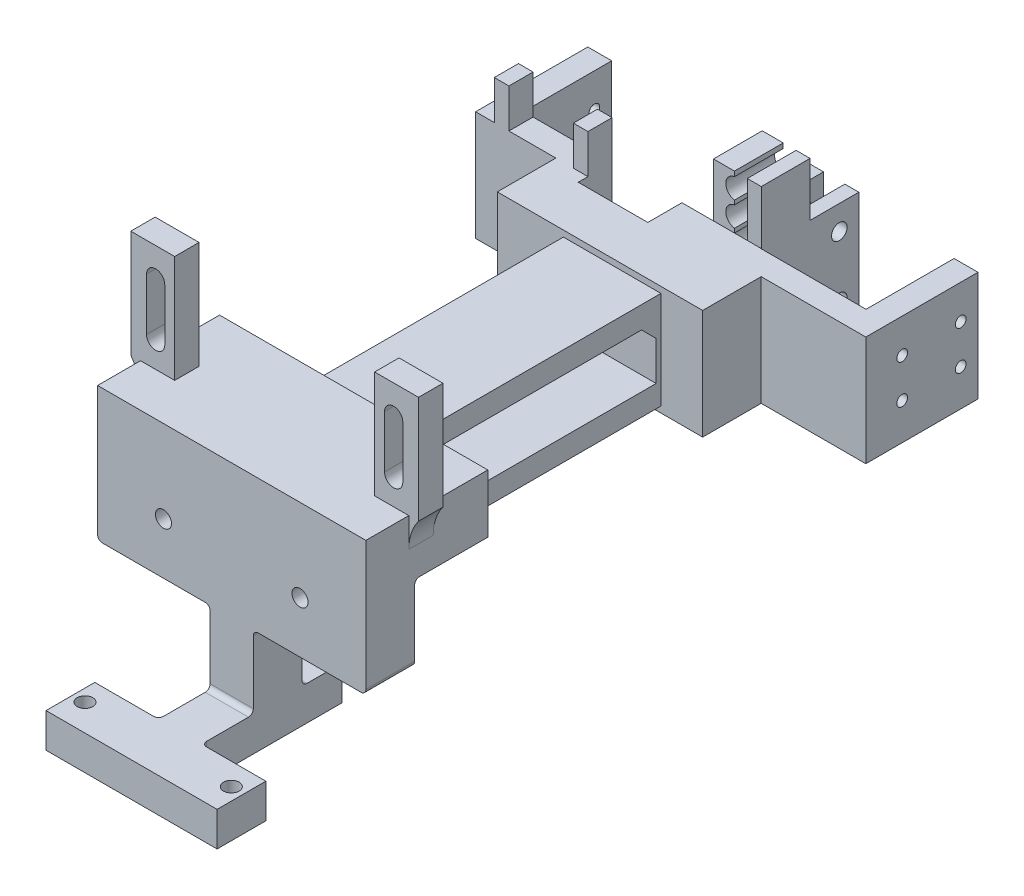
from build123d import *

# Parameters (mm, degrees)
SKETCH_1_W            = 35
SKETCH_1_H            = 40
EXTRUDE_1_DEPTH       = 5
SKETCH_2_W            = 20
SKETCH_2_H            = 20
EXTRUDE_2_DEPTH       = 65
SKETCH_3_W            = 56
SKETCH_3_H            = 11
SKETCH_3_W_2          = 4.5
CUT_EXTRUDE_1_DEPTH   = 78.821912081
SKETCH_5_W            = 55
SKETCH_5_H            = 20
EXTRUDE_3_DEPTH       = 25
SKETCH_9_R            = 1.65
CUT_EXTRUDE_3_DEPTH   = 27
SKETCH_10_W           = 55
SKETCH_10_H           = 25
EXTRUDE_4_DEPTH       = 4.9
SKETCH_11_W           = 7
SKETCH_11_H           = 5
EXTRUDE_5_DEPTH       = 21
CHAMFER_2_SIZE        = 10
CHAMFER_3_SIZE        = 3
CHAMFER_4_SIZE        = 2
CUT_EXTRUDE_7_DEPTH   = 15
SKETCH_16_W           = 12.984556049
SKETCH_16_H           = 11
EXTRUDE_6_DEPTH       = 20
CHAMFER_5_SIZE        = 3
SKETCH_19_R           = 1.6
CUT_EXTRUDE_10_DEPTH  = 10
FILLET_1_R            = 5
SKETCH_20_W           = 5
SKETCH_20_H           = 22.5
EXTRUDE_7_DEPTH       = 17.5
SKETCH_21_W           = 5
SKETCH_21_H           = 22.5
EXTRUDE_8_DEPTH       = 5
SKETCH_22_W           = 5
SKETCH_22_H           = 22.5
EXTRUDE_9_DEPTH       = 10
SKETCH_23_W           = 5
SKETCH_23_H           = 22.5
EXTRUDE_10_DEPTH      = 10
SKETCH_24_W           = 3.3
SKETCH_24_H           = 22.5
EXTRUDE_11_DEPTH      = 4
SKETCH_26_W           = 5
SKETCH_26_H           = 22.5
EXTRUDE_13_DEPTH      = 17.5
SKETCH_27_W           = 5
SKETCH_27_H           = 22.5
EXTRUDE_14_DEPTH      = 5
SKETCH_28_W           = 5
SKETCH_28_H           = 22.5
EXTRUDE_15_DEPTH      = 10
SKETCH_29_W           = 5
SKETCH_29_H           = 22.5
EXTRUDE_16_DEPTH      = 10
SKETCH_31_W           = 3.4
SKETCH_31_H           = 22.5
EXTRUDE_18_DEPTH      = 4
SKETCH_39_W           = 7.13678645
SKETCH_39_H           = 13.518332953
SKETCH_39_W_2         = 8.139264071
SKETCH_39_H_2         = 10.52230198
CUT_EXTRUDE_17_DEPTH  = 35
SKETCH_40_W           = 55
SKETCH_40_H           = 10
EXTRUDE_20_DEPTH      = 25.575713879
SKETCH_41_W           = 8.84873954
SKETCH_41_H           = 7.046133319
EXTRUDE_21_DEPTH      = 20.577981656
EXTRUDE_22_DEPTH      = 13.07563
EXTRUDE_22_DEPTH_BACK = 22
SKETCH_42_W           = 38.79276714
SKETCH_42_H           = 7.046133319
SKETCH_43_W           = 23.07563023
SKETCH_43_H           = 28.79276714
CUT_EXTRUDE_18_DEPTH  = 22
FILLET_3_R            = 1
SKETCH_46_W           = 9.238205764
SKETCH_46_H           = 22.5
EXTRUDE_26_DEPTH      = 10
CUT_EXTRUDE_19_DEPTH  = 10
SKETCH_48_R           = 1.6
CUT_EXTRUDE_20_DEPTH  = 10
CUT_EXTRUDE_21_DEPTH  = 10
SKETCH_50_W           = 2.57104036
SKETCH_50_H           = 22.5
SKETCH_50_W_2         = 2.865096637
EXTRUDE_27_DEPTH      = 10
SKETCH_53_W           = 4.304606657
SKETCH_53_H           = 10
SKETCH_53_W_2         = 2.865096637
EXTRUDE_28_DEPTH      = 11
SKETCH_51_R           = 1.6
CUT_EXTRUDE_22_DEPTH  = 12
SKETCH_52_W           = 17.2
SKETCH_52_H           = 6.8
CUT_EXTRUDE_23_DEPTH  = 39
CUT_EXTRUDE_24_DEPTH  = 10
SKETCH_55_W           = 32
SKETCH_55_H           = 22.5
EXTRUDE_29_DEPTH      = 12
SKETCH_56_W           = 10.301119562
SKETCH_56_H           = 22.5
CUT_EXTRUDE_25_DEPTH  = 7
SKETCH_57_W           = 3
SKETCH_57_H           = 4.95
EXTRUDE_30_DEPTH      = 8
SKETCH_58_W           = 9
SKETCH_58_H           = 22.5
SKETCH_58_W_2         = 8.434386946
CUT_EXTRUDE_26_DEPTH  = 10.05
CUT_EXTRUDE_27_DEPTH  = 1
SKETCH_60_W           = 2.55
SKETCH_60_H           = 22.5
EXTRUDE_31_DEPTH      = 12
SKETCH_61_W           = 3.965384327
SKETCH_61_H           = 22.5
CUT_EXTRUDE_28_DEPTH  = 6.95
SKETCH_62_W           = 5
SKETCH_62_H           = 22
EXTRUDE_32_DEPTH      = 2
SKETCH_63_W           = 5
SKETCH_63_H           = 22
EXTRUDE_33_DEPTH      = 2
FILLET_4_R            = 10
SKETCH_64_W           = 5
SKETCH_64_H           = 22.5
EXTRUDE_34_DEPTH      = 8
SKETCH_65_W           = 0.1
SKETCH_65_H           = 22.5
CUT_EXTRUDE_30_DEPTH  = 15
SKETCH_66_W           = 5
SKETCH_66_H           = 22.5
EXTRUDE_35_DEPTH      = 8
SKETCH_67_R           = 1.1
CUT_EXTRUDE_31_DEPTH  = 9
SKETCH_68_W           = 0.1
SKETCH_68_H           = 22.5
CUT_EXTRUDE_32_DEPTH  = 12
SKETCH_69_W           = 12
SKETCH_69_H           = 22.5
EXTRUDE_36_DEPTH      = 5


with BuildPart() as part:
    # 草图1 → 凸台-拉伸1 (new body)
    with BuildSketch(Plane.XY):
        Rectangle(SKETCH_1_W, SKETCH_1_H)
    extrude(amount=EXTRUDE_1_DEPTH)

    # 草图2 → 凸台-拉伸2 (add)
    with BuildSketch(Plane.XY.offset(5)):
        Rectangle(SKETCH_2_W, SKETCH_2_H)
    extrude(amount=EXTRUDE_2_DEPTH)

    # 草图3 → 切除-拉伸1 (cut, through all)
    with BuildSketch(Plane.ZY.offset(10)):
        with Locations((37.5, 0)):
            Rectangle(SKETCH_3_W, SKETCH_3_H)
        with Locations((7.25, 0)):
            Rectangle(SKETCH_3_W_2, SKETCH_3_H)
    extrude(amount=-CUT_EXTRUDE_1_DEPTH, mode=Mode.SUBTRACT)

    # 草图5 → 凸台-拉伸3 (add)
    with BuildSketch(Plane.XY.offset(70)):
        Rectangle(SKETCH_5_W, SKETCH_5_H)
    extrude(amount=EXTRUDE_3_DEPTH)

    # 草图9 → 切除-拉伸3 (cut)
    with BuildSketch(Plane.XY.offset(95)):
        with Locations((-14, -3.042747006)):
            Circle(SKETCH_9_R)
        with Locations((14, -3.042747006)):
            Circle(SKETCH_9_R)
    extrude(amount=-CUT_EXTRUDE_3_DEPTH, mode=Mode.SUBTRACT)

    # 草图10 → 凸台-拉伸4 (add)
    with BuildSketch(Plane(origin=(0, 10, 0), x_dir=(1, 0, 0), z_dir=(0, 1, 0))):
        with Locations((0, -82.5)):
            Rectangle(SKETCH_10_W, SKETCH_10_H)
    extrude(amount=EXTRUDE_4_DEPTH)

    # 草图11 → 凸台-拉伸5 (add)
    with BuildSketch(Plane(origin=(0, 14.9, 0), x_dir=(1, 0, 0), z_dir=(0, 1, 0))):
        with Locations((-24, -83.7)):
            Rectangle(SKETCH_11_W, SKETCH_11_H)
        with Locations((24, -83.7)):
            Rectangle(SKETCH_11_W, SKETCH_11_H)
    extrude(amount=EXTRUDE_5_DEPTH)

    # 倒角2
    chamfer_2_edges = [part.edges().sort_by_distance(p)[0] for p in [
        (0, -5.5, 65.5),
    ]]
    chamfer(chamfer_2_edges, length=CHAMFER_2_SIZE)

    # 倒角3
    chamfer_3_edges = [part.edges().sort_by_distance(p)[0] for p in [
        (0, 10, 70),
    ]]
    chamfer(chamfer_3_edges, length=CHAMFER_3_SIZE)

    # 倒角4
    chamfer_4_edges = [part.edges().sort_by_distance(p)[0] for p in [
        (0, -10, 5),
    ]]
    chamfer(chamfer_4_edges, length=CHAMFER_4_SIZE)

    # 草图15 → 切除-拉伸7 (cut)
    with BuildSketch(Plane(origin=(0, 0, 70), x_dir=(-1, 0, 0), z_dir=(0, 0, -1))):
        Polygon((10, 1.957252994), (29.13083687, 1.957252994), (29.13083687, -8.042747006), (29.13083687, -10), (10, -10), (10, -8.042747006), align=None)
        Polygon((-29.13083687, 1.957252994), (-29.13083687, -8.042747006), (-29.13083687, -10), (-10, -10), (-10, -8.042747006), (-10, 1.957252994), align=None)
    extrude(amount=-CUT_EXTRUDE_7_DEPTH, mode=Mode.SUBTRACT)

    # 草图16 → 凸台-拉伸6 (add)
    with BuildSketch(Plane.ZY.offset(10)):
        with Locations((11.492278025, 0)):
            Rectangle(SKETCH_16_W, SKETCH_16_H)
    extrude(amount=-EXTRUDE_6_DEPTH)

    # 倒角5
    chamfer_5_edges = [part.edges().sort_by_distance(p)[0] for p in [
        (0, 5.5, 17.984556049),
    ]]
    chamfer(chamfer_5_edges, length=CHAMFER_5_SIZE)

    # 草图19 → 切除-拉伸10 (cut)
    with BuildSketch(Plane.XY.offset(86.2)):
        with Locations((-24.4, 29.9)):
            Circle(SKETCH_19_R)
        with Locations((-24.4, 19.9)):
            Circle(SKETCH_19_R)
        with Locations((24.4, 19.9)):
            Circle(SKETCH_19_R)
        with Locations((24.4, 29.9)):
            Circle(SKETCH_19_R)
    extrude(amount=-CUT_EXTRUDE_10_DEPTH, mode=Mode.SUBTRACT)

    # 圆角1
    fillet_1_edges = [part.edges().sort_by_distance(p)[0] for p in [
        (17.5, -20, 2.5),
        (-17.5, -20, 2.5),
        (-17.5, 20, 2.5),
        (17.5, 20, 2.5),
    ]]
    fillet(fillet_1_edges, radius=FILLET_1_R)

    # 草图20 → 凸台-拉伸7 (add)
    with BuildSketch(Plane.ZY.offset(17.5)):
        with Locations((2.5, 0)):
            Rectangle(SKETCH_20_W, SKETCH_20_H)
    extrude(amount=EXTRUDE_7_DEPTH)

    # 草图21 → 凸台-拉伸8 (add)
    with BuildSketch(Plane.ZY.offset(35)):
        with Locations((2.5, 0)):
            Rectangle(SKETCH_21_W, SKETCH_21_H)
    extrude(amount=EXTRUDE_8_DEPTH)

    # 草图22 → 凸台-拉伸9 (add)
    with BuildSketch(Plane(origin=(0, 0, 0), x_dir=(-1, 0, 0), z_dir=(0, 0, -1))):
        with Locations((37.5, 0)):
            Rectangle(SKETCH_22_W, SKETCH_22_H)
    extrude(amount=EXTRUDE_9_DEPTH)

    # 草图23 → 凸台-拉伸10 (add)
    with BuildSketch(Plane(origin=(0, 0, 0), x_dir=(-1, 0, 0), z_dir=(0, 0, -1))):
        with Locations((15.5, 0)):
            Rectangle(SKETCH_23_W, SKETCH_23_H)
    extrude(amount=EXTRUDE_10_DEPTH)

    # 草图24 → 凸台-拉伸11 (add)
    with BuildSketch(Plane.ZY.offset(18)):
        with Locations((-8.35, 0)):
            Rectangle(SKETCH_24_W, SKETCH_24_H)
    extrude(amount=EXTRUDE_11_DEPTH)

    # 草图26 → 凸台-拉伸13 (add)
    with BuildSketch(Plane(origin=(17.5, 0, 0), x_dir=(0, 0, -1), z_dir=(1, 0, 0))):
        with Locations((-2.5, 0)):
            Rectangle(SKETCH_26_W, SKETCH_26_H)
    extrude(amount=EXTRUDE_13_DEPTH)

    # 草图27 → 凸台-拉伸14 (add)
    with BuildSketch(Plane(origin=(35, 0, 0), x_dir=(0, 0, -1), z_dir=(1, 0, 0))):
        with Locations((-2.5, 0)):
            Rectangle(SKETCH_27_W, SKETCH_27_H)
    extrude(amount=EXTRUDE_14_DEPTH)

    # 草图28 → 凸台-拉伸15 (add)
    with BuildSketch(Plane(origin=(0, 0, 0), x_dir=(-1, 0, 0), z_dir=(0, 0, -1))):
        with Locations((-37.5, 0)):
            Rectangle(SKETCH_28_W, SKETCH_28_H)
    extrude(amount=EXTRUDE_15_DEPTH)

    # 草图29 → 凸台-拉伸16 (add)
    with BuildSketch(Plane(origin=(0, 0, 0), x_dir=(-1, 0, 0), z_dir=(0, 0, -1))):
        with Locations((-15.5, 0)):
            Rectangle(SKETCH_29_W, SKETCH_29_H)
    extrude(amount=EXTRUDE_16_DEPTH)

    # 草图31 → 凸台-拉伸18 (add)
    with BuildSketch(Plane(origin=(18, 0, 0), x_dir=(0, 0, -1), z_dir=(1, 0, 0))):
        with Locations((8.3, 0)):
            Rectangle(SKETCH_31_W, SKETCH_31_H)
    extrude(amount=EXTRUDE_18_DEPTH)

    # 草图39 → 切除-拉伸17 (cut)
    with BuildSketch(Plane.ZY.offset(17.5)):
        with Locations((3.568393225, 18.009166476)):
            Rectangle(SKETCH_39_W, SKETCH_39_H)
        with Locations((4.069632036, -16.51115099)):
            Rectangle(SKETCH_39_W_2, SKETCH_39_H_2)
    extrude(amount=-CUT_EXTRUDE_17_DEPTH, mode=Mode.SUBTRACT)

    # 草图40 → 凸台-拉伸20 (add)
    with BuildSketch(Plane.XZ.offset(10)):
        with Locations((0, 90)):
            Rectangle(SKETCH_40_W, SKETCH_40_H)
    extrude(amount=EXTRUDE_20_DEPTH)

    # 草图41 → 凸台-拉伸21 (add)
    with BuildSketch(Plane.XY.offset(95)):
        with Locations((0, -32.05264722)):
            Rectangle(SKETCH_41_W, SKETCH_41_H)
    extrude(amount=EXTRUDE_21_DEPTH)

    # 草图42 → 凸台-拉伸22 (add, two sides: drawn at the far end of the back side and taken through both)
    with BuildSketch(Plane.ZY.offset(4.42436977).offset(-EXTRUDE_22_DEPTH_BACK)):
        with Locations((96.181598086, -32.05264722)):
            Rectangle(SKETCH_42_W, SKETCH_42_H)
    extrude(amount=EXTRUDE_22_DEPTH + EXTRUDE_22_DEPTH_BACK)

    # 草图43 → 切除-拉伸18 (cut)
    with BuildSketch(Plane.XZ.offset(35.575713879)):
        with Locations((15.962184885, 91.181598086)):
            Rectangle(SKETCH_43_W, SKETCH_43_H)
        with Locations((-15.962184885, 91.181598086)):
            Rectangle(SKETCH_43_W, SKETCH_43_H)
    extrude(amount=-CUT_EXTRUDE_18_DEPTH, mode=Mode.SUBTRACT)

    # 圆角3
    fillet_3_edges = [part.edges().sort_by_distance(p)[0] for p in [
        (-18.75, 1.957252994, 85),
        (18.75, 1.957252994, 85),
        (0, -10, 85),
        (0, -28.52958056, 85),
        (0, -28.52958056, 95),
        (4.42436977, -32.052647219, 105.577981656),
        (27.5, -13.575713879, 90),
        (4.42436977, -13.575713879, 90),
        (-27.5, -13.575713879, 90),
        (-4.42436977, -32.052647219, 105.577981656),
        (-4.42436977, -13.575713879, 90),
    ]]
    fillet(fillet_3_edges, radius=FILLET_3_R)

    # 草图46 → 凸台-拉伸26 (add)
    with BuildSketch(Plane(origin=(0, 0, 0), x_dir=(-1, 0, 0), z_dir=(0, 0, -1))):
        with Locations((-8.380897118, 0)):
            Rectangle(SKETCH_46_W, SKETCH_46_H)
    extrude(amount=EXTRUDE_26_DEPTH)

    # 草图47 → 切除-拉伸19 (cut)
    with BuildSketch(Plane(origin=(0, 0, -10), x_dir=(-1, 0, 0), z_dir=(0, 0, -1))):
        with BuildLine():
            Line((-8.066400893, 11.25), (-10.700516417, 11.25))
            Line((-10.700516417, 11.25), (-10.700516417, -11.25))
            Line((-10.700516417, -11.25), (-6.332834596, -11.25))
            ThreePointArc((-6.332834596, -11.25), (-6.663682414, -9.62836823), (-8.066400893, -8.75))
            Line((-8.066400893, -8.75), (-8.066400893, -7.900028072))
            ThreePointArc((-8.066400893, -7.900028072), (-6.289381928, -5.825014036), (-8.066400893, -3.75))
            Line((-8.066400893, -3.75), (-8.066400893, -2.900028072))
            ThreePointArc((-8.066400893, -2.900028072), (-6.289381928, -0.825014036), (-8.066400893, 1.25))
            Line((-8.066400893, 1.25), (-8.066400893, 2.099971928))
            ThreePointArc((-8.066400893, 2.099971928), (-6.289381928, 4.174985964), (-8.066400893, 6.25))
            Line((-8.066400893, 6.25), (-8.066400893, 7.099971928))
            ThreePointArc((-8.066400893, 7.099971928), (-6.289381928, 9.174985964), (-8.066400893, 11.25))
        make_face()
    extrude(amount=-CUT_EXTRUDE_19_DEPTH, mode=Mode.SUBTRACT)

    # 草图48 → 切除-拉伸20 (cut)
    with BuildSketch(Plane(origin=(0, -28.52958056, 0), x_dir=(1, 0, 0), z_dir=(0, 1, 0))):
        with Locations(Location((15, -110.089556655, 0), (0, 0, 270))):
            Circle(SKETCH_48_R)
        with Locations(Location((-15, -110.089556655, 0), (0, 0, 270))):
            Circle(SKETCH_48_R)
    extrude(amount=-CUT_EXTRUDE_20_DEPTH, mode=Mode.SUBTRACT)

    # 草图49 → 切除-拉伸21 (cut)
    with BuildSketch(Plane.XY.offset(86.2)):
        with BuildLine():
            Line((-22.528691915, 29.9), (-22.528691915, 19.165676086))
            ThreePointArc((-22.528691915, 19.165676086), (-24.4, 17.294368), (-26.271308085, 19.165676086))
            Line((-26.271308085, 19.165676086), (-26.271308085, 29.9))
            ThreePointArc((-26.271308085, 29.9), (-24.4, 31.771308085), (-22.528691915, 29.9))
        make_face()
        with BuildLine():
            Line((22.528691915, 29.9), (22.528691915, 19.165676086))
            ThreePointArc((22.528691915, 19.165676086), (24.4, 17.294368), (26.271308085, 19.165676086))
            Line((26.271308085, 19.165676086), (26.271308085, 29.9))
            ThreePointArc((26.271308085, 29.9), (24.4, 31.771308085), (22.528691915, 29.9))
        make_face()
    extrude(amount=-CUT_EXTRUDE_21_DEPTH, mode=Mode.SUBTRACT)

    # 草图50 → 凸台-拉伸27 (add)
    with BuildSketch(Plane(origin=(0, 0, -10), x_dir=(-1, 0, 0), z_dir=(0, 0, -1))):
        with Locations((-5.047314416, 0)):
            Rectangle(SKETCH_50_W, SKETCH_50_H)
        with Locations((-12.133064736, 0)):
            Rectangle(SKETCH_50_W_2, SKETCH_50_H)
    extrude(amount=EXTRUDE_27_DEPTH)

    # 草图53 → 凸台-拉伸28 (add)
    with BuildSketch(Plane(origin=(0, 11.25, 0), x_dir=(1, 0, 0), z_dir=(0, 1, 0))):
        with Locations((5.914097565, 5)):
            Rectangle(SKETCH_53_W, SKETCH_53_H)
        with Locations((12.133064736, 5)):
            Rectangle(SKETCH_53_W_2, SKETCH_53_H)
    extrude(amount=EXTRUDE_28_DEPTH)

    # 草图51 → 切除-拉伸22 (cut)
    with BuildSketch(Plane(origin=(13.565613054, 0, 0), x_dir=(0, 0, -1), z_dir=(1, 0, 0))):
        with Locations((16, 6.25)):
            Circle(SKETCH_51_R)
        with Locations((16, -6.25)):
            Circle(SKETCH_51_R)
    extrude(amount=-CUT_EXTRUDE_22_DEPTH, mode=Mode.SUBTRACT)

    # 草图52 → 切除-拉伸23 (cut)
    with BuildSketch(Plane(origin=(0, 11.25, 0), x_dir=(1, 0, 0), z_dir=(0, 1, 0))):
        with Locations((-26.5, 3.35)):
            Rectangle(SKETCH_52_W, SKETCH_52_H)
        with Locations((26.5, 3.35)):
            Rectangle(SKETCH_52_W, SKETCH_52_H)
    extrude(amount=-CUT_EXTRUDE_23_DEPTH, mode=Mode.SUBTRACT)

    # 草图54 → 切除-拉伸24 (cut)
    with BuildSketch(Plane(origin=(0, 0, -10), x_dir=(-1, 0, 0), z_dir=(0, 0, -1))):
        with BuildLine():
            ThreePointArc((-8.066400893, 12.099971928), (-6.289381928, 14.174985964), (-8.066400893, 16.25))
            Line((-8.066400893, 16.25), (-8.066400893, 12.099971928))
        make_face()
        with BuildLine():
            ThreePointArc((-8.066400893, 17.099971928), (-6.289381928, 19.174985964), (-8.066400893, 21.25))
            Line((-8.066400893, 21.25), (-8.066400893, 17.099971928))
        make_face()
    extrude(amount=-CUT_EXTRUDE_24_DEPTH, mode=Mode.SUBTRACT)

    # 草图55 → 凸台-拉伸29 (add)
    with BuildSketch(Plane.XY.offset(5)):
        Rectangle(SKETCH_55_W, SKETCH_55_H)
    extrude(amount=EXTRUDE_29_DEPTH)

    # 草图56 → 切除-拉伸25 (cut)
    with BuildSketch(Plane(origin=(0, 0, 0), x_dir=(-1, 0, 0), z_dir=(0, 0, -1))):
        with Locations((7.849440219, 0)):
            Rectangle(SKETCH_56_W, SKETCH_56_H)
    extrude(amount=-CUT_EXTRUDE_25_DEPTH, mode=Mode.SUBTRACT)

    # 草图57 → 凸台-拉伸30 (add)
    with BuildSketch(Plane(origin=(0, 11.25, 0), x_dir=(1, 0, 0), z_dir=(0, 1, 0))):
        with Locations((-18.465384327, -2.525)):
            Rectangle(SKETCH_57_W, SKETCH_57_H)
        with Locations((-34.665384327, -2.525)):
            Rectangle(SKETCH_57_W, SKETCH_57_H)
    extrude(amount=EXTRUDE_30_DEPTH)

    # 草图58 → 切除-拉伸26 (cut)
    with BuildSketch(Plane(origin=(0, 0, -10), x_dir=(-1, 0, 0), z_dir=(0, 0, -1))):
        with Locations((17.5, 0)):
            Rectangle(SKETCH_58_W, SKETCH_58_H)
        with Locations((-17.782806527, 0)):
            Rectangle(SKETCH_58_W_2, SKETCH_58_H)
    extrude(amount=-CUT_EXTRUDE_26_DEPTH, mode=Mode.SUBTRACT)

    # 草图59 → 切除-拉伸27 (cut)
    with BuildSketch(Plane(origin=(0, 14.9, 0), x_dir=(1, 0, 0), z_dir=(0, 1, 0))):
        Polygon((20.5, -86.2), (20.5, -81.2), (27.5, -81.2), (27.5, -70), (-27.5, -70), (-27.5, -81.2), (-20.5, -81.2), (-20.5, -86.2), (-27.5, -86.2), (-27.5, -95), (27.5, -95), (27.5, -86.2), align=None)
    extrude(amount=-CUT_EXTRUDE_27_DEPTH, mode=Mode.SUBTRACT)

    # 草图60 → 凸台-拉伸31 (add)
    with BuildSketch(Plane.XY.offset(5)):
        with Locations((-17.275, 0)):
            Rectangle(SKETCH_60_W, SKETCH_60_H)
        with Locations((17.275, 0)):
            Rectangle(SKETCH_60_W, SKETCH_60_H)
    extrude(amount=EXTRUDE_31_DEPTH)

    # 草图61 → 切除-拉伸28 (cut)
    with BuildSketch(Plane(origin=(0, 0, 0.05), x_dir=(-1, 0, 0), z_dir=(0, 0, -1))):
        with Locations((14.982692164, 0)):
            Rectangle(SKETCH_61_W, SKETCH_61_H)
    extrude(amount=-CUT_EXTRUDE_28_DEPTH, mode=Mode.SUBTRACT)

    # 草图62 → 凸台-拉伸32 (add)
    with BuildSketch(Plane.ZY.offset(27.5)):
        with Locations((83.7, 24.9)):
            Rectangle(SKETCH_62_W, SKETCH_62_H)
    extrude(amount=EXTRUDE_32_DEPTH)

    # 草图63 → 凸台-拉伸33 (add)
    with BuildSketch(Plane(origin=(27.5, 0, 0), x_dir=(0, 0, -1), z_dir=(1, 0, 0))):
        with Locations((-83.7, 24.9)):
            Rectangle(SKETCH_63_W, SKETCH_63_H)
    extrude(amount=EXTRUDE_33_DEPTH)

    # 圆角4
    # the kernel refuses this fillet: 10 mm, written as the material it adds along each edge
    with BuildSketch(Plane(origin=(-27.5, 13.9, 86.2), x_dir=(-1, 0, 0), z_dir=(0, 0, -1))) as fillet_4_piece_1:
        with BuildLine():
            CenterArc((10, -6), FILLET_4_R, 143.130102354, 36.869897646)
            Line((0, -6), (0, 0))
            Line((0, 0), (2, 0))
        make_face()
    extrude(amount=5)
    with BuildSketch(Plane(origin=(27.5, 13.9, 81.2), x_dir=(0, -1, 0), z_dir=(0, 0, 1))) as fillet_4_piece_2:
        with BuildLine():
            CenterArc((6, 10), FILLET_4_R, 233.130102354, 36.869897646)
            Line((0, 2), (0, 0))
            Line((0, 0), (6, 0))
        make_face()
    extrude(amount=5)

    # 草图64 → 凸台-拉伸34 (add)
    with BuildSketch(Plane(origin=(0, 0, -10), x_dir=(-1, 0, 0), z_dir=(0, 0, -1))):
        with Locations((-37.5, 0)):
            Rectangle(SKETCH_64_W, SKETCH_64_H)
    extrude(amount=EXTRUDE_34_DEPTH)

    # 草图65 → 切除-拉伸30 (cut)
    with BuildSketch(Plane(origin=(0, 0, -18), x_dir=(-1, 0, 0), z_dir=(0, 0, -1))):
        with Locations((-35.05, 0)):
            Rectangle(SKETCH_65_W, SKETCH_65_H)
    extrude(amount=-CUT_EXTRUDE_30_DEPTH, mode=Mode.SUBTRACT)

    # 草图66 → 凸台-拉伸35 (add)
    with BuildSketch(Plane(origin=(0, 0, -10), x_dir=(-1, 0, 0), z_dir=(0, 0, -1))):
        with Locations((37.5, 0)):
            Rectangle(SKETCH_66_W, SKETCH_66_H)
    extrude(amount=EXTRUDE_35_DEPTH)

    # 草图67 → 切除-拉伸31 (cut)
    with BuildSketch(Plane(origin=(40, 0, 0), x_dir=(0, 0, -1), z_dir=(1, 0, 0))):
        with Locations(Location((2.45, 4.25, 0), (0, 0, 90))):
            Circle(SKETCH_67_R)
        with Locations(Location((2.45, -3.75, 0), (0, 0, 90))):
            Circle(SKETCH_67_R)
        with Locations(Location((14.45, -3.75, 0), (0, 0, 90))):
            Circle(SKETCH_67_R)
        with Locations(Location((14.45, 4.25, 0), (0, 0, 90))):
            Circle(SKETCH_67_R)
    cut_extrude_31 = extrude(amount=-CUT_EXTRUDE_31_DEPTH, mode=Mode.SUBTRACT)

    # 镜向1: 切除-拉伸31 across plane
    add(cut_extrude_31.mirror(Plane(origin=(0, 0, 0), x_dir=(0, 0, 1), z_dir=(1, 0, 0))), mode=Mode.SUBTRACT)

    # 草图68 → 切除-拉伸32 (cut)
    with BuildSketch(Plane(origin=(0, 0, -18), x_dir=(-1, 0, 0), z_dir=(0, 0, -1))):
        with Locations((35.05, 0)):
            Rectangle(SKETCH_68_W, SKETCH_68_H)
    extrude(amount=-CUT_EXTRUDE_32_DEPTH, mode=Mode.SUBTRACT)

    # 草图69 → 凸台-拉伸36 (add)
    with BuildSketch(Plane.ZY.offset(18.55)):
        with Locations((11, 0)):
            Rectangle(SKETCH_69_W, SKETCH_69_H)
    extrude(amount=EXTRUDE_36_DEPTH)


solid = part.part
